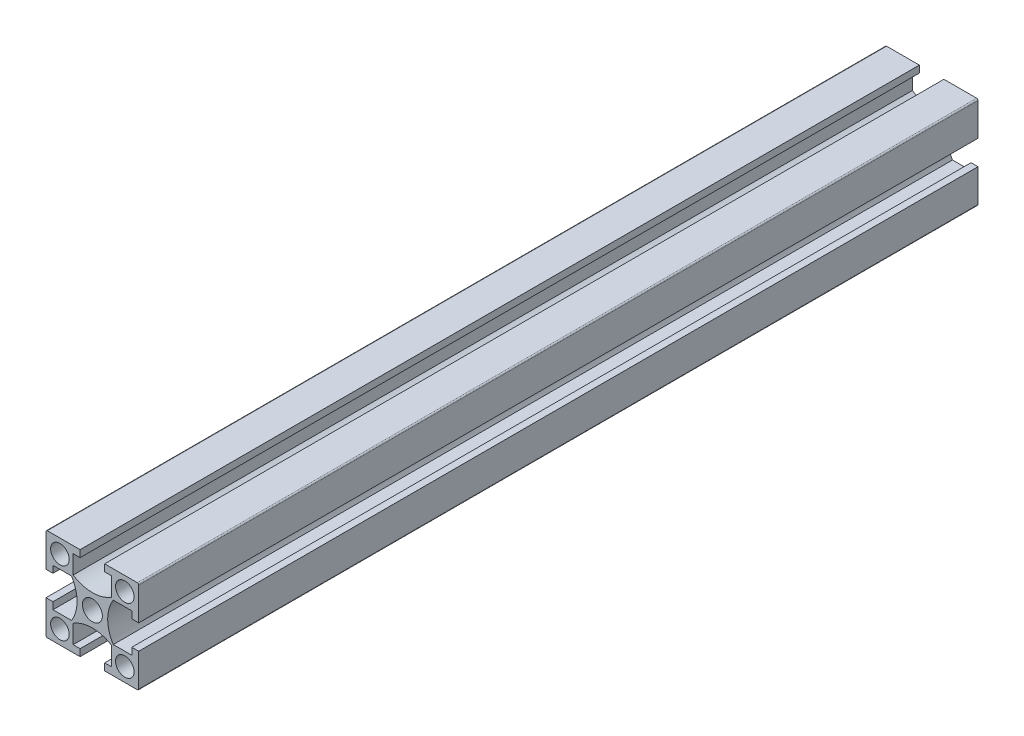
from build123d import *

# Parameters (mm, degrees)
SKETCH_1_W               = 20
SKETCH_1_H               = 20
SKETCH_1_R               = 2
SKETCH_1_R_2             = 2.15
EXTRUDE_1_DEPTH          = 181
CUT_EXTRUDE_1_REACH      = 183.552
PATTERN_CIRCULAR_1_COUNT = 4
FILLET_1_R               = 0.3
SKETCH_2_R               = 2.5
CUT_EXTRUDE_2_DEPTH      = 183.375985261


with BuildPart() as part:
    # 스케치1 → 보스-돌출1 (new body)
    with BuildSketch(Plane.XY):
        Rectangle(SKETCH_1_W, SKETCH_1_H)
        with Locations((-7, -7)):
            Circle(SKETCH_1_R, mode=Mode.SUBTRACT)
        with Locations((7, -7)):
            Circle(SKETCH_1_R, mode=Mode.SUBTRACT)
        with Locations((-7, 7)):
            Circle(SKETCH_1_R, mode=Mode.SUBTRACT)
        Circle(SKETCH_1_R_2, mode=Mode.SUBTRACT)
        with Locations((7, 7)):
            Circle(SKETCH_1_R, mode=Mode.SUBTRACT)
    extrude(amount=EXTRUDE_1_DEPTH)

    # 스케치1<3> → 컷-돌출1 (cut, up to next)
    with BuildSketch(Plane.XY, mode=Mode.PRIVATE) as cut_extrude_1_sk1:
        with BuildLine():
            Line((-8.5, 2.65), (-10, 2.65))
            Line((-10, 2.65), (-10, -2.65))
            Line((-10, -2.65), (-8.5, -2.65))
            Line((-8.5, -2.65), (-8.5, -4.15))
            Line((-8.5, -4.15), (-4.503166667, -4.15))
            ThreePointArc((-4.503166667, -4.15), (-3.3, 0), (-4.503166667, 4.15))
            Line((-4.503166667, 4.15), (-8.5, 4.15))
            Line((-8.5, 4.15), (-8.5, 2.65))
        make_face()
    cut_extrude_1_tool1 = extrude(cut_extrude_1_sk1.sketch, amount=CUT_EXTRUDE_1_REACH, mode=Mode.PRIVATE) & part.part
    cut_extrude_1 = cut_extrude_1_tool1.solids().sort_by_distance((-6.606913, 0, 0))[0]
    add(cut_extrude_1, mode=Mode.SUBTRACT)

    # 원형 패턴1: 컷-돌출1 ×4 about axis
    pattern_circular_1_axis = Axis((0, 0, 181), (0, 0, -1))
    for i in range(1, PATTERN_CIRCULAR_1_COUNT):
        add(cut_extrude_1.rotate(pattern_circular_1_axis, i * 360 / PATTERN_CIRCULAR_1_COUNT), mode=Mode.SUBTRACT)

    # 필렛1
    fillet_1_edges = [part.edges().sort_by_distance(p)[0] for p in [
        (10, -10, 90.5),
        (-10, -10, 90.5),
        (-10, 10, 90.5),
        (10, 10, 90.5),
    ]]
    fillet(fillet_1_edges, radius=FILLET_1_R)

    # 스케치2 → 컷-돌출2 (cut, through all)
    with BuildSketch(Plane.ZY.offset(10)):
        with Locations((11, 0)):
            Circle(SKETCH_2_R)
    extrude(amount=-CUT_EXTRUDE_2_DEPTH, mode=Mode.SUBTRACT)


solid = part.part
